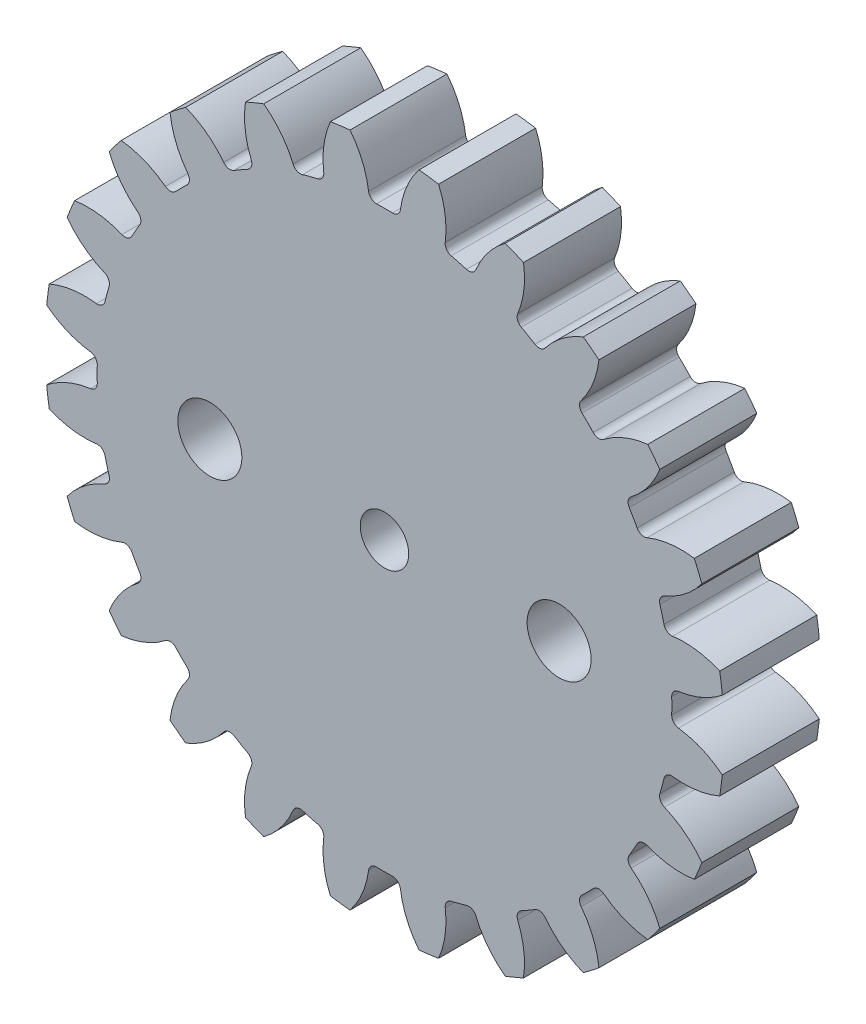
from build123d import *

# Parameters (mm, degrees)
SKETCH1_R                      = 17.5
BOSS_EXTRUDE1_DEPTH            = 2.5
CUT_EXTRUDE1_DEPTH             = 25.874685928
FILLET2_R                      = 0.403846154
CIRPATTERN1_COUNT              = 24
FILLET2_OF_CIRPATTERN1_R       = 0.403846154
THROUGH_CENTER_HOLE_DEPTH      = 25.747223817
THROUGH_CENTER_HOLE_DEPTH_BACK = 25.747223817
SKETCH4_R                      = 1.25
TO_KNUCKLE_MOUNT_DEPTH         = 25.747223817
TO_KNUCKLE_MOUNT_DEPTH_BACK    = 25.747223817
SKETCH5_R                      = 1.65


with BuildPart() as part:
    # Sketch1 → Boss-Extrude1 (new, symmetric)
    with BuildSketch(Plane.XY):
        Circle(SKETCH1_R)
    extrude(amount=BOSS_EXTRUDE1_DEPTH, both=True)

    # Sketch3 → Cut-Extrude1 (cut, symmetric)
    with BuildSketch(Plane.XY):
        with BuildLine():
            ThreePointArc((-0.784965964, 14.786871877), (0, 14.807692308), (0.784965964, 14.786871877))
            ThreePointArc((0.784965964, 14.786871877), (1.077399634, 16.175506036), (1.778330792, 17.409409513))
            ThreePointArc((1.778330792, 17.409409513), (0, 17.5), (-1.778330792, 17.409409513))
            ThreePointArc((-1.778330792, 17.409409513), (-1.077399634, 16.175506036), (-0.784965964, 14.786871877))
        make_face()
    cut_extrude1 = extrude(amount=CUT_EXTRUDE1_DEPTH, both=True, mode=Mode.SUBTRACT)

    # Fillet2
    fillet2_edges = [part.edges().sort_by_distance(p)[0] for p in [
        (0.784965964, 14.786871877, 0),
        (-0.784965964, 14.786871877, 0),
    ]]
    fillet(fillet2_edges, radius=FILLET2_R)

    # CirPattern1: Cut-Extrude1 ×24 about axis
    cirpattern1_axis = Axis((0, 0, 2.5), (0, 0, -1))
    for i in range(1, CIRPATTERN1_COUNT):
        add(cut_extrude1.rotate(cirpattern1_axis, i * 360 / CIRPATTERN1_COUNT), mode=Mode.SUBTRACT)

    # Fillet2 of CirPattern1
    fillet2_of_cirpattern1_edges = [part.edges().sort_by_distance(p)[0] for p in [
        (4.585342957, 14.079857295, 0),
        (3.068905162, 14.486185578, 0),
        (8.073236405, 12.413323706, 0),
        (6.713635472, 13.19828967, 0),
        (11.010952133, 9.900842621, 0),
        (9.900842621, 11.010952133, 0),
        (13.19828967, 6.713635472, 0),
        (12.413323706, 8.073236405, 0),
        (14.486185578, 3.068905162, 0),
        (14.079857295, 4.585342957, 0),
        (14.786871877, -0.784965964, 0),
        (14.786871877, 0.784965964, 0),
        (14.079857295, -4.585342957, 0),
        (14.486185578, -3.068905162, 0),
        (12.413323706, -8.073236405, 0),
        (13.19828967, -6.713635472, 0),
        (9.900842621, -11.010952133, 0),
        (11.010952133, -9.900842621, 0),
        (6.713635472, -13.19828967, 0),
        (8.073236405, -12.413323706, 0),
        (3.068905162, -14.486185578, 0),
        (4.585342957, -14.079857295, 0),
        (-0.784965964, -14.786871877, 0),
        (0.784965964, -14.786871877, 0),
        (-4.585342957, -14.079857295, 0),
        (-3.068905162, -14.486185578, 0),
        (-8.073236405, -12.413323706, 0),
        (-6.713635472, -13.19828967, 0),
        (-11.010952133, -9.900842621, 0),
        (-9.900842621, -11.010952133, 0),
        (-13.19828967, -6.713635472, 0),
        (-12.413323706, -8.073236405, 0),
        (-14.486185578, -3.068905162, 0),
        (-14.079857295, -4.585342957, 0),
        (-14.786871877, 0.784965964, 0),
        (-14.786871877, -0.784965964, 0),
        (-14.079857295, 4.585342957, 0),
        (-14.486185578, 3.068905162, 0),
        (-12.413323706, 8.073236405, 0),
        (-13.19828967, 6.713635472, 0),
        (-9.900842621, 11.010952133, 0),
        (-11.010952133, 9.900842621, 0),
        (-6.713635472, 13.19828967, 0),
        (-8.073236405, 12.413323706, 0),
        (-3.068905162, 14.486185578, 0),
        (-4.585342957, 14.079857295, 0),
    ]]
    fillet(fillet2_of_cirpattern1_edges, radius=FILLET2_OF_CIRPATTERN1_R)

    # Sketch4 → Through_Center_Hole (cut, two sides: drawn at the far end of the back side and taken through both)
    with BuildSketch(Plane.XY.offset(-THROUGH_CENTER_HOLE_DEPTH_BACK)):
        Circle(SKETCH4_R)
    extrude(amount=THROUGH_CENTER_HOLE_DEPTH + THROUGH_CENTER_HOLE_DEPTH_BACK, mode=Mode.SUBTRACT)

    # Sketch5 → To_Knuckle_Mount (cut, two sides: drawn at the far end of the back side and taken through both)
    with BuildSketch(Plane.XY.offset(-TO_KNUCKLE_MOUNT_DEPTH_BACK)):
        with Locations((9, 0)):
            Circle(SKETCH5_R)
        with Locations((-9, 0)):
            Circle(SKETCH5_R)
    extrude(amount=TO_KNUCKLE_MOUNT_DEPTH + TO_KNUCKLE_MOUNT_DEPTH_BACK, mode=Mode.SUBTRACT)


solid = part.part
